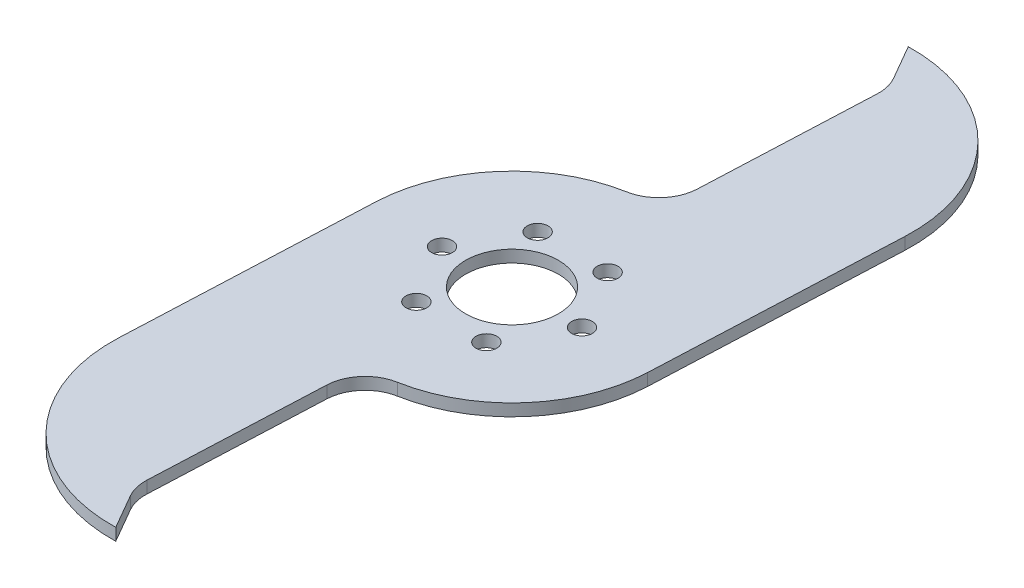
from build123d import *

# Parameters (mm, degrees)
BOSS_EXTRUDE1_DEPTH = 3.02
CIRPATTERN1_COUNT   = 2
SKETCH1_R           = 2.6
SKETCH1_R_2         = 11.6
CUT_EXTRUDE3_DEPTH  = 109.570027256


with BuildPart() as part:
    # Sketch2 → Boss-Extrude1 (new body)
    with BuildSketch(Plane(origin=(0, 0, 0), x_dir=(1, 0, 0), z_dir=(0, 1, 0))):
        with BuildLine():
            Line((-2.5, 101.569237469), (2.5, 92.908983431))
            ThreePointArc((2.5, 92.908983431), (3.553316941, 90.285228124), (3.830172933, 87.47152607))
            Line((3.830172933, 87.47152607), (1.941763785, 44.345005958))
            ThreePointArc((1.941763785, 44.345005958), (-0.519823663, 38.20093041), (-6.279726222, 34.940163688))
            ThreePointArc((-6.279726222, 34.940163688), (-23.364441828, -26.727380307), (35.466015746, -1.552973632))
            Line((35.466015746, -1.552973632), (38.166377664, 60.116507632))
            ThreePointArc((38.166377664, 60.116507632), (26.836369136, 89.675263851), (-2.5, 101.569237469))
        make_face()
    extrude(amount=BOSS_EXTRUDE1_DEPTH)


with BuildPart() as cirpattern1_1:
    # CirPattern1: pattern copy
    add(part.part.rotate(Axis((0, -0.15, 0), (0, 1, 0)), 1 * 360 / CIRPATTERN1_COUNT))


with BuildPart() as part_1:
    add(part.part)

    # Combine1: union CirPattern1_1
    add(cirpattern1_1.part)

    # Sketch1 → Cut-Extrude3 (cut, through all)
    with BuildSketch(Plane(origin=(0, 0, 0), x_dir=(1, 0, 0), z_dir=(0, 1, 0))):
        with Locations((8.75, 15.155444566)):
            Circle(SKETCH1_R)
        with Locations((17.5, 0)):
            Circle(SKETCH1_R)
        with Locations((8.75, -15.155444566)):
            Circle(SKETCH1_R)
        with Locations((-8.75, -15.155444566)):
            Circle(SKETCH1_R)
        with Locations((-17.5, 0)):
            Circle(SKETCH1_R)
        with Locations((-8.75, 15.155444566)):
            Circle(SKETCH1_R)
        Circle(SKETCH1_R_2)
    extrude(amount=CUT_EXTRUDE3_DEPTH, mode=Mode.SUBTRACT)


solid = part_1.part
